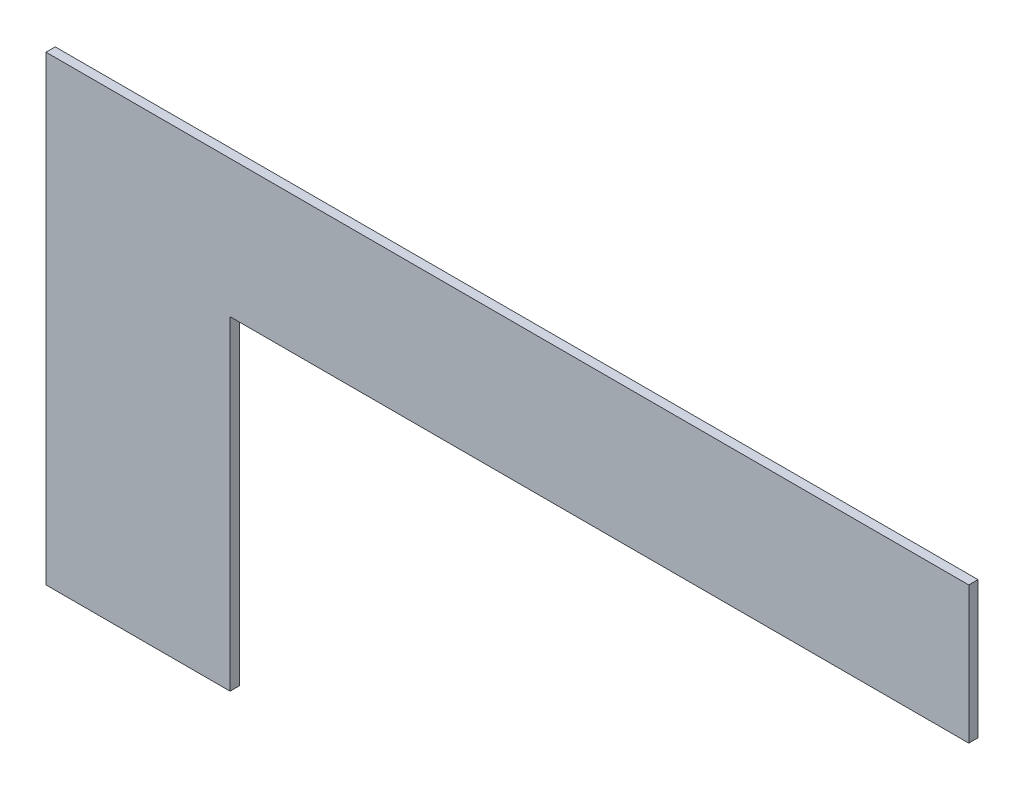
from build123d import *

# Parameters (mm, degrees)
TABAN_FLAN_1_DEPTH         = 40
KES_EKSTR_ZYON1_DEPTH      = 4473.31483686
KES_EKSTR_ZYON1_DEPTH_BACK = 4473.31483686
IZIM2_W                    = 3200
IZIM2_H                    = 350
KES_EKSTR_ZYON2_DEPTH      = 4473.31483686
KES_EKSTR_ZYON2_DEPTH_BACK = 4473.31483686
IZIM3_W                    = 3200
IZIM3_H                    = 6
KES_EKSTR_ZYON3_DEPTH      = 4473.31483686
KES_EKSTR_ZYON3_DEPTH_BACK = 4473.31483686
IZIM4_W                    = 2
IZIM4_H                    = 1406


# Sheet-metal steps are written as plain solids
with BuildPart() as part:
    # Çizim1 → Taban-Flanş1 (new body)
    with BuildSketch(Plane.XY):
        Polygon((0, 0), (4000, 0), (4000, -950), (800, -950), (800, -2000), (0, -2000), align=None)
    extrude(amount=-TABAN_FLAN_1_DEPTH)

    # Çizim2 → Kes-Ekstrüzyon1 (cut, two sides: drawn at the far end of the back side and taken through both)
    with BuildSketch(Plane.XY.offset(-KES_EKSTR_ZYON1_DEPTH_BACK)):
        with Locations((2400, -775)):
            Rectangle(IZIM2_W, IZIM2_H)
    extrude(amount=KES_EKSTR_ZYON1_DEPTH + KES_EKSTR_ZYON1_DEPTH_BACK, mode=Mode.SUBTRACT)

    # Çizim3 → Kes-Ekstrüzyon2 (cut, two sides: drawn at the far end of the back side and taken through both)
    with BuildSketch(Plane.XY.offset(-KES_EKSTR_ZYON2_DEPTH_BACK)):
        with Locations((2400, -597)):
            Rectangle(IZIM3_W, IZIM3_H)
    extrude(amount=KES_EKSTR_ZYON2_DEPTH + KES_EKSTR_ZYON2_DEPTH_BACK, mode=Mode.SUBTRACT)

    # Çizim4 → Kes-Ekstrüzyon3 (cut, two sides: drawn at the far end of the back side and taken through both)
    with BuildSketch(Plane.XY.offset(-KES_EKSTR_ZYON3_DEPTH_BACK)):
        with Locations((799, -1297)):
            Rectangle(IZIM4_W, IZIM4_H)
    extrude(amount=KES_EKSTR_ZYON3_DEPTH + KES_EKSTR_ZYON3_DEPTH_BACK, mode=Mode.SUBTRACT)


solid = part.part
